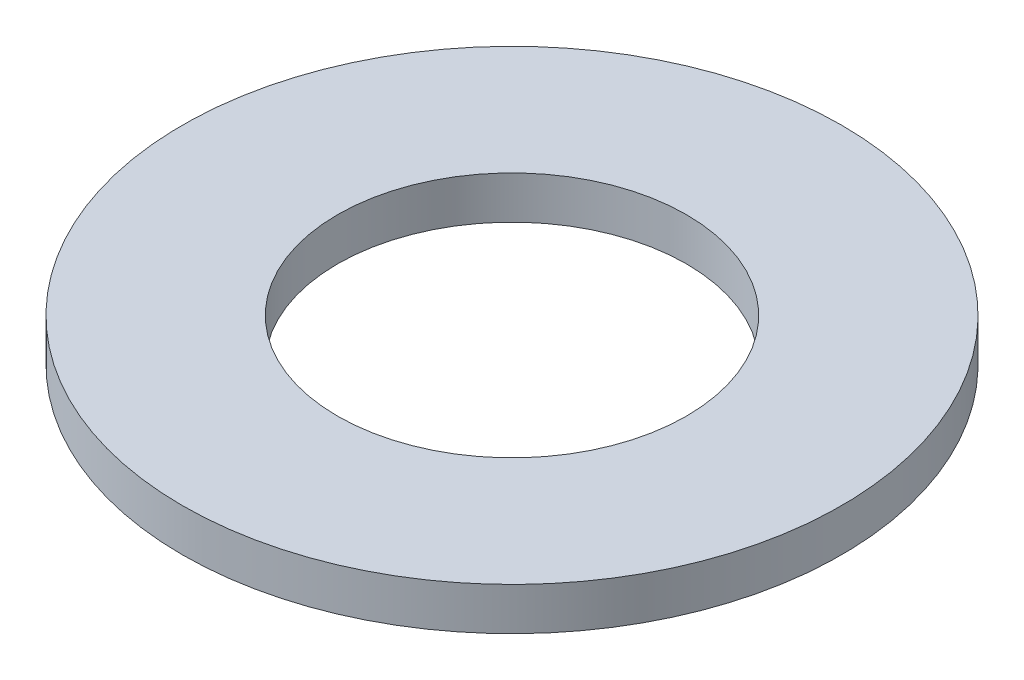
from build123d import *

# Parameters (mm, degrees)
SKETCH1_R           = 85
BOSS_EXTRUDE1_DEPTH = 11
SKETCH2_R           = 45
CUT_EXTRUDE1_DEPTH  = 121.710397232


with BuildPart() as part:
    # Sketch1 → Boss-Extrude1 (new body)
    with BuildSketch(Plane(origin=(0, 0, 0), x_dir=(1, 0, 0), z_dir=(0, 1, 0))):
        Circle(SKETCH1_R)
    extrude(amount=BOSS_EXTRUDE1_DEPTH)

    # Sketch2 → Cut-Extrude1 (cut, through all)
    with BuildSketch(Plane(origin=(0, 0, 0), x_dir=(1, 0, 0), z_dir=(0, 1, 0))):
        Circle(SKETCH2_R)
    extrude(amount=CUT_EXTRUDE1_DEPTH, mode=Mode.SUBTRACT)


solid = part.part
